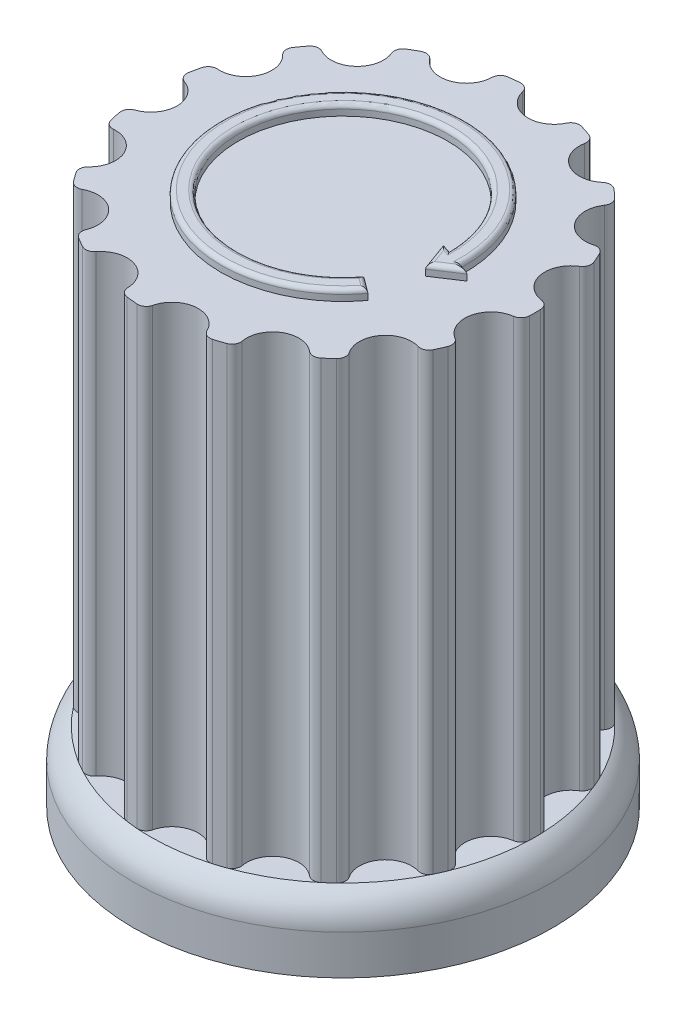
from build123d import *

# Parameters (mm, degrees)
SKETCH1_R                = 6
BOSS_EXTRUDE1_DEPTH      = 15
CUT_EXTRUDE1_START       = -13
SKETCH2_R                = 6
SKETCH2_R_2              = 5.5
CUT_EXTRUDE1_DEPTH       = 13
FILLET1_R                = 1
SKETCH3_R                = 0.75
CUT_EXTRUDE2_DEPTH       = 13
FILLET2_R                = 0.25
CIRPATTERN1_COUNT        = 15
FILLET2_OF_CIRPATTERN1_R = 0.25
SKETCH4_R                = 3.5
CUT_EXTRUDE3_DEPTH       = 14
BOSS_EXTRUDE2_START      = 7
BOSS_EXTRUDE2_DEPTH      = 7
BOSS_EXTRUDE4_DEPTH      = 0.3
FILLET5_R                = 0.125


with BuildPart() as part:
    # Sketch1 → Boss-Extrude1 (new body)
    with BuildSketch(Plane(origin=(0, 0, 0), x_dir=(1, 0, 0), z_dir=(0, 1, 0))):
        with Locations(Location((0, 0, 0), (0, 0, 270))):
            Circle(SKETCH1_R)
    extrude(amount=BOSS_EXTRUDE1_DEPTH)

    # Sketch2 → Cut-Extrude1 (cut)
    with BuildSketch(Plane(origin=(0, 15, 0), x_dir=(1, 0, 0), z_dir=(0, 1, 0)).offset(CUT_EXTRUDE1_START)):
        with Locations(Location((0, 0, 0), (0, 0, 270))):
            Circle(SKETCH2_R)
        with Locations(Location((0, 0, 0), (0, 0, 270))):
            Circle(SKETCH2_R_2, mode=Mode.SUBTRACT)
    extrude(amount=CUT_EXTRUDE1_DEPTH, mode=Mode.SUBTRACT)

    # Fillet1
    # the kernel refuses this fillet: 1 mm, written as the material it takes off along each edge
    with BuildSketch(Plane(origin=(0, 2, 0), x_dir=(0, 0, 1), z_dir=(-1, 0, 0))) as fillet1_piece_1:
        with BuildLine():
            CenterArc((5, -0.866025404), FILLET1_R, 0, 60)
            Line((5.5, 0), (5.51, 0.017320508))
            ThreePointArc((5.51, 0.017320508), (5.75, 0.02), (6, 0.02))
            Line((6, 0.02), (6.02, 0))
            Line((6.02, 0), (6.02, -0.866025404))
            Line((6.02, -0.866025404), (6, -0.866025404))
        make_face()
    revolve(axis=Axis((0, 2, 0), (0, 1, 0)), mode=Mode.SUBTRACT)

    # Sketch3 → Cut-Extrude2 (cut)
    with BuildSketch(Plane(origin=(0, 15, 0), x_dir=(1, 0, 0), z_dir=(0, 1, 0))):
        with Locations((-5.5, 0)):
            Circle(SKETCH3_R)
    cut_extrude2 = extrude(amount=-CUT_EXTRUDE2_DEPTH, mode=Mode.SUBTRACT)

    # Fillet2
    fillet2_edges = [part.edges().sort_by_distance(p)[0] for p in [
        (-5.448863636, 8.5, 0.748254684),
        (-5.448863636, 8.5, -0.748254684),
    ]]
    fillet(fillet2_edges, radius=FILLET2_R)

    # CirPattern1: Cut-Extrude2 ×15 about axis
    cirpattern1_axis = Axis((0, 0, 0), (0, 1, 0))
    for i in range(1, CIRPATTERN1_COUNT):
        add(cut_extrude2.rotate(cirpattern1_axis, i * 360 / CIRPATTERN1_COUNT), mode=Mode.SUBTRACT)

    # Fillet2 of CirPattern1
    fillet2_of_cirpattern1_edges = [part.edges().sort_by_distance(p)[0] for p in [
        (-4.673442026, 8.5, 2.899817172),
        (-5.282127223, 8.5, 1.532687836),
        (-3.089939832, 8.5, 4.549974927),
        (-4.202063026, 8.5, 3.548614706),
        (-0.97215897, 8.5, 5.413400681),
        (-2.395423957, 8.5, 4.950953854),
        (1.313717009, 8.5, 5.340800279),
        (-0.174594324, 8.5, 5.497228104),
        (3.372439383, 8.5, 4.344726989),
        (2.076424253, 8.5, 5.092981673),
        (4.84803635, 8.5, 2.597410932),
        (3.968410214, 8.5, 3.808112443),
        (5.485363789, 8.5, 0.400978928),
        (5.174221996, 8.5, 1.864785976),
        (5.174221996, 8.5, -1.864785976),
        (5.485363789, 8.5, -0.400978928),
        (3.968410214, 8.5, -3.808112443),
        (4.84803635, 8.5, -2.597410932),
        (2.076424253, 8.5, -5.092981673),
        (3.372439383, 8.5, -4.344726989),
        (-0.174594324, 8.5, -5.497228104),
        (1.313717009, 8.5, -5.340800279),
        (-2.395423957, 8.5, -4.950953854),
        (-0.97215897, 8.5, -5.413400681),
        (-4.202063026, 8.5, -3.548614706),
        (-3.089939832, 8.5, -4.549974927),
        (-5.282127223, 8.5, -1.532687836),
        (-4.673442026, 8.5, -2.899817172),
    ]]
    fillet(fillet2_of_cirpattern1_edges, radius=FILLET2_OF_CIRPATTERN1_R)

    # Sketch4 → Cut-Extrude3 (cut)
    with BuildSketch(Plane.XZ):
        with Locations(Location((0, 0, 0), (0, 0, 270))):
            Circle(SKETCH4_R)
    extrude(amount=-CUT_EXTRUDE3_DEPTH, mode=Mode.SUBTRACT)

    # Sketch5 → Boss-Extrude2 (add)
    with BuildSketch(Plane.XZ.offset(-14).offset(BOSS_EXTRUDE2_START)):
        with BuildLine():
            Line((1.1, -0.635085296), (1.1, -3.322649545))
            ThreePointArc((1.1, -3.322649545), (3.5, 0), (1.1, 3.322649545))
            Line((1.1, 3.322649545), (1.1, -0.635085296))
        make_face()
    extrude(amount=-BOSS_EXTRUDE2_DEPTH)

    # Sketch7 → Boss-Extrude4 (add)
    with BuildSketch(Plane(origin=(0, 15, 0), x_dir=(1, 0, 0), z_dir=(0, 1, 0))):
        with BuildLine():
            Line((3.029048445, -0.664919024), (3.73938401, -0.198096375))
            Line((3.73938401, -0.198096375), (3.498014017, -0.117889503))
            ThreePointArc((3.498014017, -0.117889503), (-3.302359604, 1.159491719), (2.803908246, -2.094778878))
            Line((2.803908246, -2.094778878), (2.403349925, -1.795524752))
            ThreePointArc((2.403349925, -1.795524752), (-2.854367744, 0.923355176), (2.999620348, 0.047725935))
            Line((2.999620348, 0.047725935), (2.73938401, 0.134202065))
            Line((2.73938401, 0.134202065), (3.029048445, -0.664919024))
        make_face()
    extrude(amount=BOSS_EXTRUDE4_DEPTH)

    # Fillet5
    fillet5_edges = [part.edges().sort_by_distance(p)[0] for p in [
        (2.869502179, 15.3, -0.090964),
        (2.884216228, 15.3, 0.26535848),
        (3.384216228, 15.3, 0.4315077),
        (3.618699014, 15.3, 0.157992939),
        (-3.302359604, 15.3, -1.159491719),
        (2.603629086, 15.3, 1.945151815),
        (-2.854367744, 15.3, -0.923355176),
    ]]
    fillet(fillet5_edges, radius=FILLET5_R)


solid = part.part
